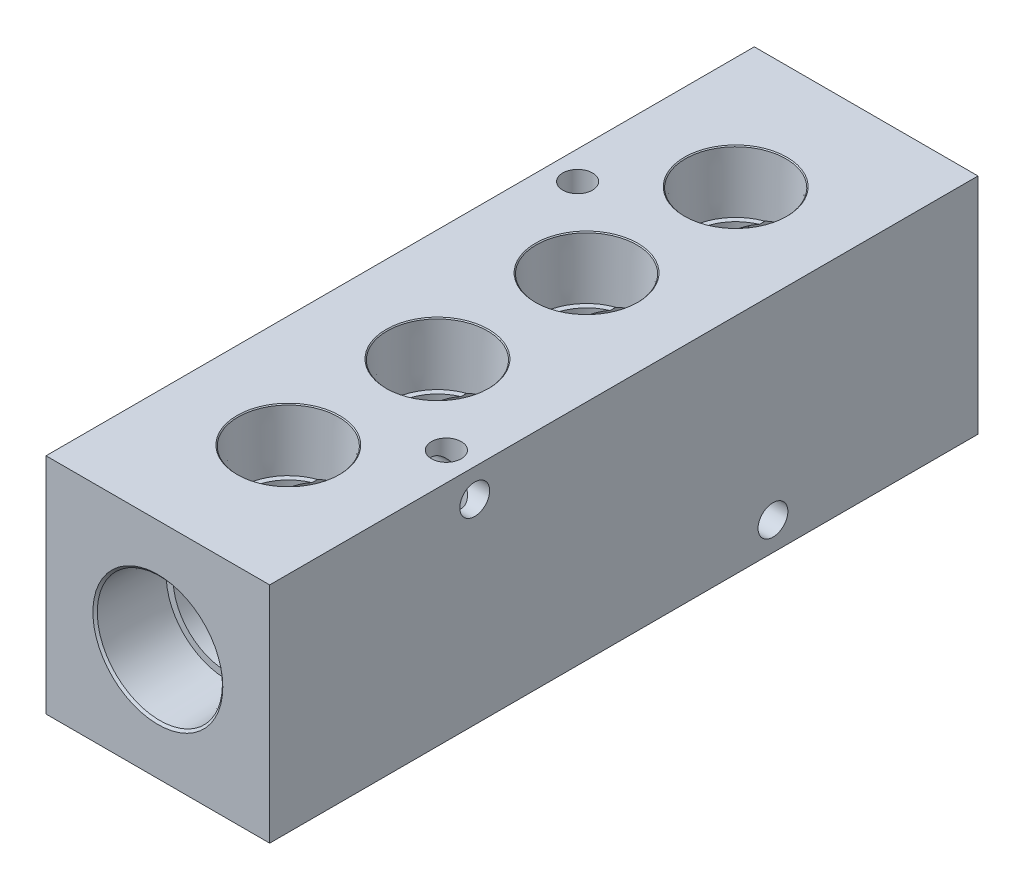
from build123d import *

# Parameters (mm, degrees)
SKETCH1_W                    = 38.1
SKETCH1_H                    = 38.1
BOSS_EXTRUDE1_DEPTH          = 60.325
SKETCH3_R                    = 8.5725
CUT_EXTRUDE1_DEPTH           = 10.35812
CUT_EXTRUDE1_DRAFT           = -1.783333333
LPATTERN1_COUNT              = 4
LPATTERN1_PITCH              = 25.4
LPATTERN1_COPY_1_SKETCH_R    = 8.5725
LPATTERN1_COPY_1_DEPTH       = 10.35812
LPATTERN1_COPY_1_DRAFT       = -1.783333333
LPATTERN1_COPY_2_SKETCH_R    = 8.5725
LPATTERN1_COPY_2_DEPTH       = 10.35812
LPATTERN1_COPY_2_DRAFT       = -1.783333333
LPATTERN1_COPY_3_SKETCH_R    = 8.5725
LPATTERN1_COPY_3_DEPTH       = 10.35812
LPATTERN1_COPY_3_DRAFT       = -1.783333333
SKETCH8_R                    = 10.668
CUT_EXTRUDE3_DEPTH           = 11.721742741
CUT_EXTRUDE3_DRAFT           = -1.783333333
SKETCH15_R                   = 7.3675875
CUT_EXTRUDE7_DEPTH           = 19.05
SKETCH13_R                   = 11.064875
CUT_EXTRUDE6_DEPTH           = 5.08
CUT_EXTRUDE6_TAPER           = 50
CUT_EXTRUDE6_OTHER_WAY_DEPTH = 5.08
CUT_EXTRUDE6_OTHER_WAY_TAPER = 45
CIRPATTERN2_COUNT            = 2
CIRPATTERN2_COPY_1_SKETCH_R  = 10.668
CIRPATTERN2_COPY_1_DEPTH     = 11.721742741
CIRPATTERN2_COPY_1_DRAFT     = -1.783333333
SKETCH12_R                   = 2.54
CUT_EXTRUDE5_DEPTH           = 74.848616352
CIRPATTERN3_COUNT            = 2
CIRPATTERN3_ANGLE            = 90


# Read off the part's stored shape, not the designer's step: Cut-Extrude2
with BuildPart() as part:
    # Sketch1 → Boss-Extrude1 (new, symmetric)
    with BuildSketch(Plane.XY):
        Rectangle(SKETCH1_W, SKETCH1_H)
    extrude(amount=BOSS_EXTRUDE1_DEPTH, both=True)

    # Sketch2 → Cut-Revolve1 (revolve, cut)
    with BuildSketch(Plane(origin=(0, 0, 0), x_dir=(0, 0, -1), z_dir=(1, 0, 0)), mode=Mode.PRIVATE) as cut_revolve1_sk:
        Polygon((-38.1, 19.05), (-38.1, -4.411631326), (-30.7578125, 0), (-30.7578125, 19.05), align=None)
    cut_revolve1 = revolve(cut_revolve1_sk.sketch.rotate(Axis((0, 26.3921875, 38.1), (0, -1, 0)), 180), axis=Axis((0, 26.3921875, 38.1), (0, -1, 0)), mode=Mode.SUBTRACT)


with BuildPart() as cut_extrude1_tool:
    # Sketch3 → Cut-Extrude1 (with draft: the straight prism first)
    with BuildSketch(Plane(origin=(0, 19.05, 0), x_dir=(1, 0, 0), z_dir=(0, 1, 0))):
        with Locations((0, -38.1)):
            Circle(SKETCH3_R)
    extrude(amount=-CUT_EXTRUDE1_DEPTH)
    # Cut-Extrude1: the draft: its side faces are tilted about the plane it starts from
    cut_extrude1_sides = [cut_extrude1_tool.faces().sort_by_distance(p)[0] for p in [
        (-8.5725, 13.87094, 38.1),
    ]]
    draft(cut_extrude1_sides, Plane(origin=(0, 19.05, 0), x_dir=(1, 0, 0), z_dir=(0, 1, 0)), CUT_EXTRUDE1_DRAFT)


with BuildPart() as part_1:
    add(part.part)

    # Cut-Extrude1: cut by cut_extrude1_tool
    add(cut_extrude1_tool.part, mode=Mode.SUBTRACT)

    # Cut-Extrude2 outline → Cut-Extrude2 (revolve, cut)
    with BuildSketch(Plane.XY.offset(38.1)):
        Polygon((8.567591048, 19.05), (8.567591048, 18.892333789), (8.725257259, 19.05), align=None)
    cut_extrude2 = revolve(axis=Axis((0, 0, 38.1), (0, 1, 0)), mode=Mode.SUBTRACT)

    # LPattern1: Cut-Revolve1, Cut-Extrude2 ×4
    with Locations(*[(0, 0, -i * LPATTERN1_PITCH) for i in range(1, LPATTERN1_COUNT)]):
        add(cut_revolve1, mode=Mode.SUBTRACT)
        add(cut_extrude2, mode=Mode.SUBTRACT)


with BuildPart() as lpattern1_copy_1_tool:
    # LPattern1 copy 1 sketch → LPattern1 copy 1 (with draft: the straight prism first)
    with BuildSketch(Plane(origin=(0, 19.05, -25.4), x_dir=(1, 0, 0), z_dir=(0, 1, 0))):
        with Locations((0, -38.1)):
            Circle(LPATTERN1_COPY_1_SKETCH_R)
    extrude(amount=-LPATTERN1_COPY_1_DEPTH)
    # LPattern1 copy 1: the draft: its side faces are tilted about the plane it starts from
    lpattern1_copy_1_sides = [lpattern1_copy_1_tool.faces().sort_by_distance(p)[0] for p in [
        (-8.5725, 13.87094, 12.7),
    ]]
    draft(lpattern1_copy_1_sides, Plane(origin=(0, 19.05, -25.4), x_dir=(1, 0, 0), z_dir=(0, 1, 0)), LPATTERN1_COPY_1_DRAFT)


with BuildPart() as part_2:
    add(part_1.part)

    # LPattern1 copy 1: cut by lpattern1_copy_1_tool
    add(lpattern1_copy_1_tool.part, mode=Mode.SUBTRACT)


with BuildPart() as lpattern1_copy_2_tool:
    # LPattern1 copy 2 sketch → LPattern1 copy 2 (with draft: the straight prism first)
    with BuildSketch(Plane(origin=(0, 19.05, -50.8), x_dir=(1, 0, 0), z_dir=(0, 1, 0))):
        with Locations((0, -38.1)):
            Circle(LPATTERN1_COPY_2_SKETCH_R)
    extrude(amount=-LPATTERN1_COPY_2_DEPTH)
    # LPattern1 copy 2: the draft: its side faces are tilted about the plane it starts from
    lpattern1_copy_2_sides = [lpattern1_copy_2_tool.faces().sort_by_distance(p)[0] for p in [
        (-8.5725, 13.87094, -12.7),
    ]]
    draft(lpattern1_copy_2_sides, Plane(origin=(0, 19.05, -50.8), x_dir=(1, 0, 0), z_dir=(0, 1, 0)), LPATTERN1_COPY_2_DRAFT)


with BuildPart() as part_3:
    add(part_2.part)

    # LPattern1 copy 2: cut by lpattern1_copy_2_tool
    add(lpattern1_copy_2_tool.part, mode=Mode.SUBTRACT)


with BuildPart() as lpattern1_copy_3_tool:
    # LPattern1 copy 3 sketch → LPattern1 copy 3 (with draft: the straight prism first)
    with BuildSketch(Plane(origin=(0, 19.05, -76.2), x_dir=(1, 0, 0), z_dir=(0, 1, 0))):
        with Locations((0, -38.1)):
            Circle(LPATTERN1_COPY_3_SKETCH_R)
    extrude(amount=-LPATTERN1_COPY_3_DEPTH)
    # LPattern1 copy 3: the draft: its side faces are tilted about the plane it starts from
    lpattern1_copy_3_sides = [lpattern1_copy_3_tool.faces().sort_by_distance(p)[0] for p in [
        (-8.5725, 13.87094, -38.1),
    ]]
    draft(lpattern1_copy_3_sides, Plane(origin=(0, 19.05, -76.2), x_dir=(1, 0, 0), z_dir=(0, 1, 0)), LPATTERN1_COPY_3_DRAFT)


with BuildPart() as part_4:
    add(part_3.part)

    # LPattern1 copy 3: cut by lpattern1_copy_3_tool
    add(lpattern1_copy_3_tool.part, mode=Mode.SUBTRACT)

    # Sketch7 → Cut-Revolve2 (revolve, cut)
    with BuildSketch(Plane(origin=(0, 0, 0), x_dir=(0, 0, -1), z_dir=(1, 0, 0)), mode=Mode.PRIVATE) as cut_revolve2_sk:
        Polygon((-60.325, 0), (5.484730838, 0), (0, 9.128125), (-60.325, 9.128125), align=None)
    cut_revolve2 = revolve(cut_revolve2_sk.sketch.rotate(Axis((0, 0, 69.453125), (0, 0, -1)), 180), axis=Axis((0, 0, 69.453125), (0, 0, -1)), mode=Mode.SUBTRACT)


with BuildPart() as cut_extrude3_tool:
    # Sketch8 → Cut-Extrude3 (with draft: the straight prism first)
    with BuildSketch(Plane.XY.offset(60.325)):
        Circle(SKETCH8_R)
    extrude(amount=-CUT_EXTRUDE3_DEPTH)
    # Cut-Extrude3: the draft: its side faces are tilted about the plane it starts from
    cut_extrude3_sides = [cut_extrude3_tool.faces().sort_by_distance(p)[0] for p in [
        (-10.668, 0, 54.464128629),
    ]]
    draft(cut_extrude3_sides, Plane.XY.offset(60.325), CUT_EXTRUDE3_DRAFT)


with BuildPart() as part_5:
    add(part_4.part)

    # Cut-Extrude3: cut by cut_extrude3_tool
    add(cut_extrude3_tool.part, mode=Mode.SUBTRACT)

    # Sketch15 → Cut-Extrude7 (cut)
    with BuildSketch(Plane(origin=(0, 19.05, 0), x_dir=(1, 0, 0), z_dir=(0, 1, 0))):
        with Locations((0, -38.1)):
            Circle(SKETCH15_R)
    cut_extrude7 = extrude(amount=-CUT_EXTRUDE7_DEPTH, mode=Mode.SUBTRACT)

    # Sketch13 → Cut-Extrude6 (cut)
    with BuildSketch(Plane.XY.offset(60.325)):
        Circle(SKETCH13_R)
    cut_extrude6 = extrude(amount=-CUT_EXTRUDE6_DEPTH, taper=CUT_EXTRUDE6_TAPER, mode=Mode.SUBTRACT)

    # Sketch13 → Cut-Extrude6 other way (cut)
    with BuildSketch(Plane.XY.offset(60.325)):
        Circle(SKETCH13_R)
    extrude(amount=CUT_EXTRUDE6_OTHER_WAY_DEPTH, taper=CUT_EXTRUDE6_OTHER_WAY_TAPER, mode=Mode.SUBTRACT)

    # CirPattern2: Cut-Revolve2, Cut-Extrude7, Cut-Extrude6 ×2 about axis
    cirpattern2_axis = Axis((0, 0, 0), (0, 1, 0))
    add([cut_revolve2.rotate(cirpattern2_axis, i * 360 / CIRPATTERN2_COUNT) for i in range(1, CIRPATTERN2_COUNT)], mode=Mode.SUBTRACT)
    add([cut_extrude7.rotate(cirpattern2_axis, i * 360 / CIRPATTERN2_COUNT) for i in range(1, CIRPATTERN2_COUNT)], mode=Mode.SUBTRACT)
    add([cut_extrude6.rotate(cirpattern2_axis, i * 360 / CIRPATTERN2_COUNT) for i in range(1, CIRPATTERN2_COUNT)], mode=Mode.SUBTRACT)


with BuildPart() as cirpattern2_copy_1_tool:
    # CirPattern2 copy 1 sketch → CirPattern2 copy 1 (with draft: the straight prism first)
    with BuildSketch(Plane(origin=(0, 0, -60.325), x_dir=(-1, 0, 0), z_dir=(0, 0, -1))):
        Circle(CIRPATTERN2_COPY_1_SKETCH_R)
    extrude(amount=-CIRPATTERN2_COPY_1_DEPTH)
    # CirPattern2 copy 1: the draft: its side faces are tilted about the plane it starts from
    cirpattern2_copy_1_sides = [cirpattern2_copy_1_tool.faces().sort_by_distance(p)[0] for p in [
        (10.668, 0, -54.464128629),
    ]]
    draft(cirpattern2_copy_1_sides, Plane(origin=(0, 0, -60.325), x_dir=(-1, 0, 0), z_dir=(0, 0, -1)), CIRPATTERN2_COPY_1_DRAFT)


with BuildPart() as part_6:
    add(part_5.part)

    # CirPattern2 copy 1: cut by cirpattern2_copy_1_tool
    add(cirpattern2_copy_1_tool.part, mode=Mode.SUBTRACT)

    # Sketch12 → Cut-Extrude5 (cut, through all)
    with BuildSketch(Plane(origin=(0, 19.05, 0), x_dir=(1, 0, 0), z_dir=(0, 1, 0))):
        with Locations(Location((-14.224, 25.4, 0), (0, 0, 270))):
            Circle(SKETCH12_R)
        with Locations(Location((14.224, -25.4, 0), (0, 0, 270))):
            Circle(SKETCH12_R)
    cut_extrude5 = extrude(amount=-CUT_EXTRUDE5_DEPTH, mode=Mode.SUBTRACT)

    # CirPattern3: Cut-Extrude5 ×2 about axis
    cirpattern3_axis = Axis((0, 0, 28.228405145), (0, 0, 1))
    for i in range(1, CIRPATTERN3_COUNT):
        add(cut_extrude5.rotate(cirpattern3_axis, i * CIRPATTERN3_ANGLE / (CIRPATTERN3_COUNT - 1)), mode=Mode.SUBTRACT)


solid = part_6.part
